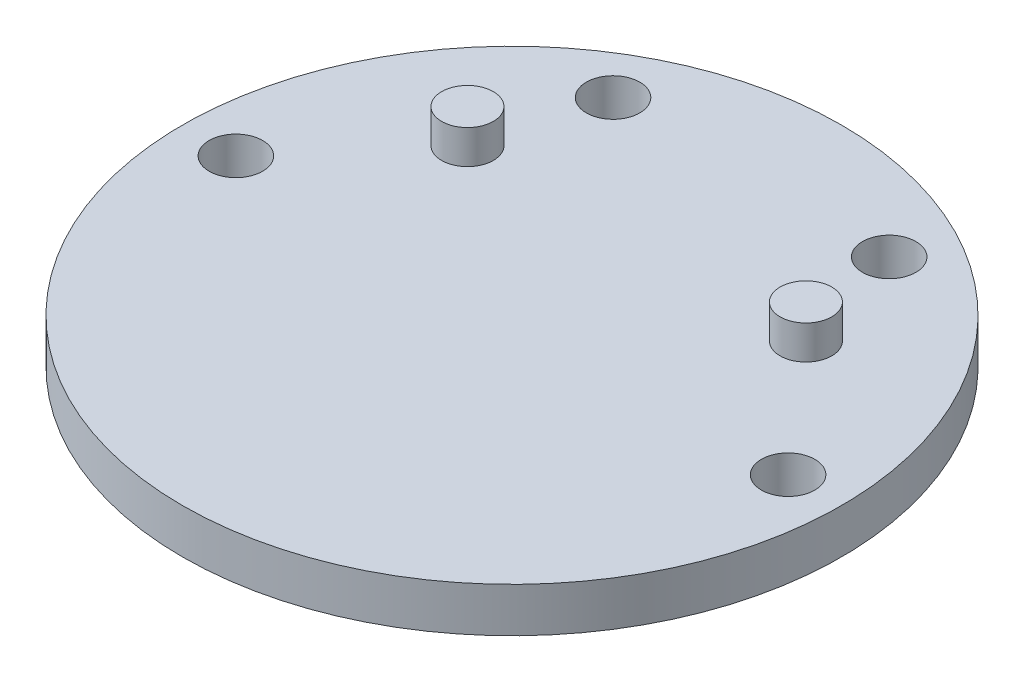
from build123d import *

# Parameters (mm, degrees)
SKETCH1_R           = 18.5
SKETCH1_R_2         = 1.5
BOSS_EXTRUDE1_DEPTH = 2.5
SKETCH2_R           = 1.45
BOSS_EXTRUDE2_DEPTH = 1.9


with BuildPart() as part:
    # Sketch1 → Boss-Extrude1 (new body)
    with BuildSketch(Plane(origin=(0, 0, 0), x_dir=(1, 0, 0), z_dir=(0, 1, 0))):
        Circle(SKETCH1_R)
        with Locations((-7.75, 13.423393759)):
            Circle(SKETCH1_R_2, mode=Mode.SUBTRACT)
        with Locations((-15.5, 0)):
            Circle(SKETCH1_R_2, mode=Mode.SUBTRACT)
        with Locations((7.75, 13.423393759)):
            Circle(SKETCH1_R_2, mode=Mode.SUBTRACT)
        with Locations((15.5, 0)):
            Circle(SKETCH1_R_2, mode=Mode.SUBTRACT)
    extrude(amount=BOSS_EXTRUDE1_DEPTH)

    # Sketch2 → Boss-Extrude2 (add)
    with BuildSketch(Plane(origin=(0, 2.5, 0), x_dir=(1, 0, 0), z_dir=(0, 1, 0))):
        with Locations((-9.5, 7)):
            Circle(SKETCH2_R)
        with Locations((9.5, 7)):
            Circle(SKETCH2_R)
    extrude(amount=BOSS_EXTRUDE2_DEPTH)


solid = part.part
